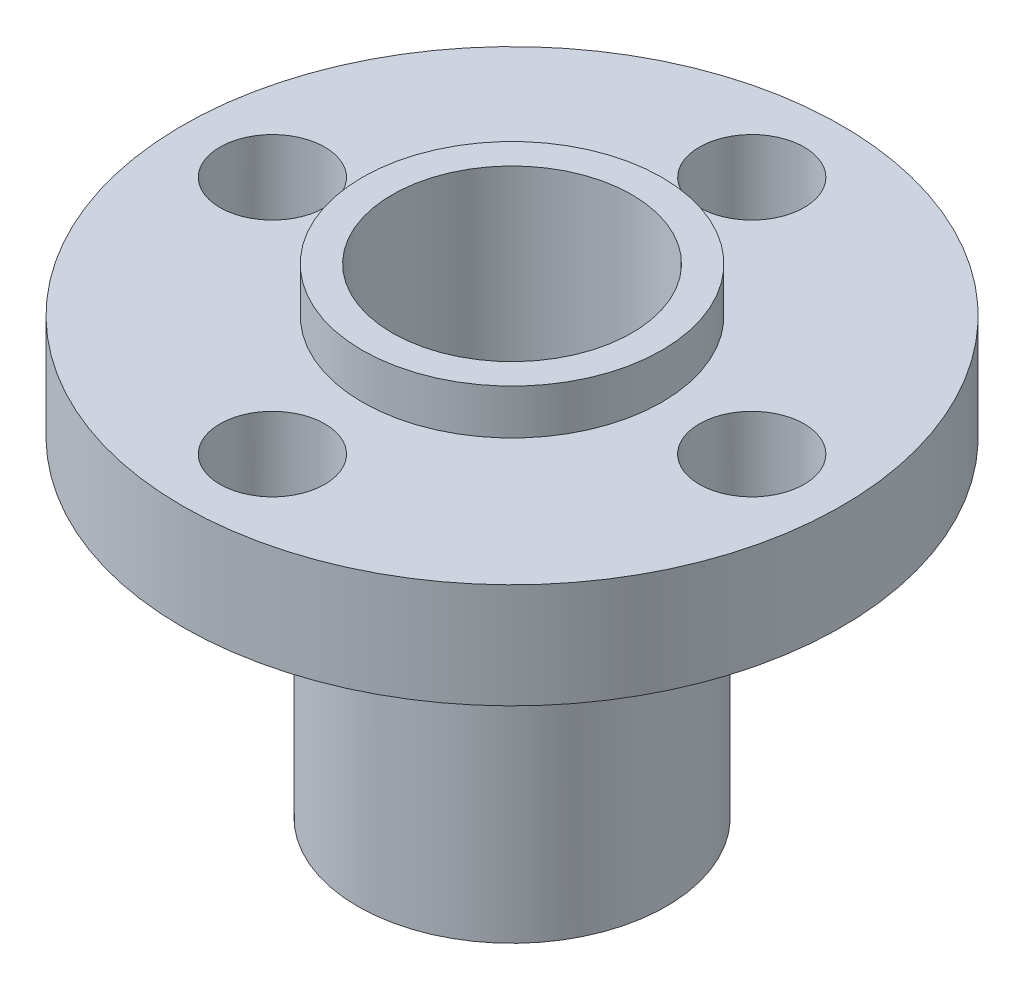
from build123d import *

# Parameters (mm, degrees)
SKETCH_1_R               = 11
EXTRUDE_2_DEPTH          = 3.5
SKETCH_2_R               = 5.15
EXTRUDE_3_DEPTH          = 11
CUT_EXTRUDE_1_DEPTH      = 22.266170318
CUT_EXTRUDE_1_DEPTH_BACK = 22.266170318
SKETCH_3_R               = 4
CUT_EXTRUDE_4_REACH      = 23.266
SKETCH_4_R               = 1.75
PATTERN_CIRCULAR_6_COUNT = 4
SKETCH_7_R               = 5
EXTRUDE_4_DEPTH          = 1.5
SKETCH_8_R               = 4
CUT_EXTRUDE_5_DEPTH      = 23.315913604


with BuildPart() as part:
    # 草图1 → 凸台-拉伸2 (new body)
    with BuildSketch(Plane(origin=(0, 0, 0), x_dir=(1, 0, 0), z_dir=(0, 1, 0))):
        Circle(SKETCH_1_R)
    extrude(amount=EXTRUDE_2_DEPTH)

    # 草图2 → 凸台-拉伸3 (add)
    with BuildSketch(Plane.XZ):
        Circle(SKETCH_2_R)
    extrude(amount=EXTRUDE_3_DEPTH)

    # 草图3 → 切除-拉伸1 (cut, two sides: drawn at the far end of the back side and taken through both)
    with BuildSketch(Plane.XZ.offset(11).offset(-CUT_EXTRUDE_1_DEPTH_BACK)):
        Circle(SKETCH_3_R)
    extrude(amount=CUT_EXTRUDE_1_DEPTH + CUT_EXTRUDE_1_DEPTH_BACK, mode=Mode.SUBTRACT)

    # 草图4 → 切除-拉伸4 (cut, up to next)
    with BuildSketch(Plane(origin=(0, 3.5, 0), x_dir=(1, 0, 0), z_dir=(0, 1, 0)), mode=Mode.PRIVATE) as cut_extrude_4_sk1:
        with Locations((0, 8)):
            Circle(SKETCH_4_R)
    cut_extrude_4_tool1 = extrude(cut_extrude_4_sk1.sketch, amount=-CUT_EXTRUDE_4_REACH, mode=Mode.PRIVATE) & part.part
    cut_extrude_4 = cut_extrude_4_tool1.solids().sort_by_distance((0, 3.5, -8))[0]
    add(cut_extrude_4, mode=Mode.SUBTRACT)

    # 阵列(圆周)6: 切除-拉伸4 ×4 about axis
    pattern_circular_6_axis = Axis((0, 3.5, 0), (0, -1, 0))
    for i in range(1, PATTERN_CIRCULAR_6_COUNT):
        add(cut_extrude_4.rotate(pattern_circular_6_axis, i * 360 / PATTERN_CIRCULAR_6_COUNT), mode=Mode.SUBTRACT)

    # 草图7 → 凸台-拉伸4 (add)
    with BuildSketch(Plane(origin=(0, 3.5, 0), x_dir=(1, 0, 0), z_dir=(0, 1, 0))):
        Circle(SKETCH_7_R)
    extrude(amount=EXTRUDE_4_DEPTH)

    # 草图8 → 切除-拉伸5 (cut, through all)
    with BuildSketch(Plane(origin=(0, 5, 0), x_dir=(1, 0, 0), z_dir=(0, 1, 0))):
        Circle(SKETCH_8_R)
    extrude(amount=-CUT_EXTRUDE_5_DEPTH, mode=Mode.SUBTRACT)


solid = part.part
